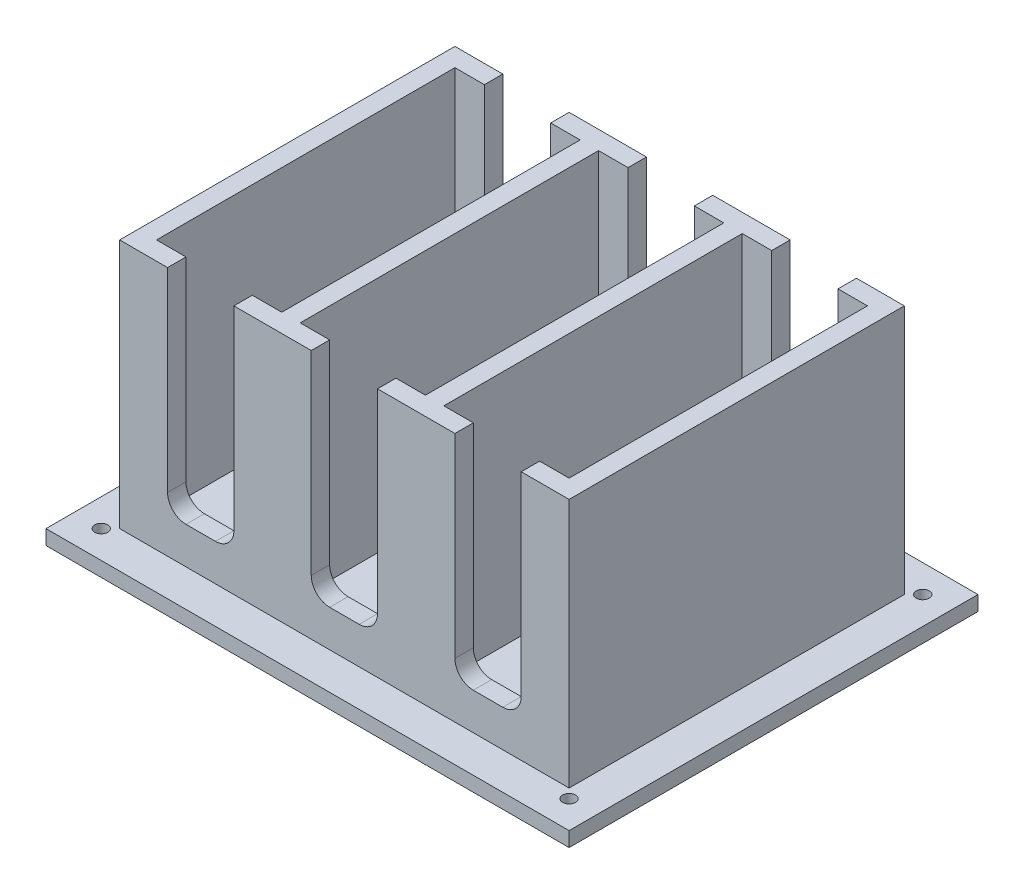
from build123d import *

# Parameters (mm, degrees)
SKETCH1_W           = 142
SKETCH1_H           = 111
SKETCH1_R           = 1.75
BOSS_EXTRUDE1_DEPTH = 4
BOSS_EXTRUDE3_DEPTH = 67.86200042
SKETCH6_W           = 122
SKETCH6_H           = 91
SKETCH6_W_2         = 112
SKETCH6_H_2         = 81
BOSS_EXTRUDE4_DEPTH = 10
FILLET1_R           = 5
SKETCH7_W           = 24.5
SKETCH7_H           = 81
BOSS_EXTRUDE5_DEPTH = 3.28853691


with BuildPart() as part:
    # Sketch1 → Boss-Extrude1 (new body)
    with BuildSketch(Plane(origin=(0, 0, 0), x_dir=(1, 0, 0), z_dir=(0, 1, 0))):
        Rectangle(SKETCH1_W, SKETCH1_H)
        with Locations((-63.5, 48)):
            Circle(SKETCH1_R, mode=Mode.SUBTRACT)
        with Locations((-63.5, -48)):
            Circle(SKETCH1_R, mode=Mode.SUBTRACT)
        with Locations((63.5, 48)):
            Circle(SKETCH1_R, mode=Mode.SUBTRACT)
        with Locations((63.5, -48)):
            Circle(SKETCH1_R, mode=Mode.SUBTRACT)
    extrude(amount=BOSS_EXTRUDE1_DEPTH)

    # Sketch5 → Boss-Extrude3 (add)
    with BuildSketch(Plane(origin=(0, 4, 0), x_dir=(1, 0, 0), z_dir=(0, 1, 0))):
        Polygon((-56, -40.5), (-56, 40.5), (-48, 40.5), (-48, 45.5), (-61, 45.5), (-61, -45.5), (-48, -45.5), (-48, -40.5), align=None)
        Polygon((-9, 45.5), (-9, 40.5), (-17, 40.5), (-17, -40.5), (-9, -40.5), (-9, -45.5), (-30, -45.5), (-30, -40.5), (-22, -40.5), (-22, 40.5), (-30, 40.5), (-30, 45.5), align=None)
        Polygon((17, -40.5), (17, 40.5), (9, 40.5), (9, 45.5), (30, 45.5), (30, 40.5), (22, 40.5), (22, -40.5), (30, -40.5), (30, -45.5), (9, -45.5), (9, -40.5), align=None)
        Polygon((56, -40.5), (56, 40.5), (48, 40.5), (48, 45.5), (61, 45.5), (61, 40.5), (61, -40.5), (61, -45.5), (48, -45.5), (48, -40.5), align=None)
    extrude(amount=BOSS_EXTRUDE3_DEPTH)

    # Sketch6 → Boss-Extrude4 (add)
    with BuildSketch(Plane(origin=(0, 4, 0), x_dir=(1, 0, 0), z_dir=(0, 1, 0))):
        Rectangle(SKETCH6_W, SKETCH6_H)
        Rectangle(SKETCH6_W_2, SKETCH6_H_2, mode=Mode.SUBTRACT)
    extrude(amount=BOSS_EXTRUDE4_DEPTH)

    # Fillet1
    fillet1_edges = [part.edges().sort_by_distance(p)[0] for p in [
        (-30, 14, -43),
        (-48, 14, -43),
        (-9, 14, -43),
        (9, 14, -43),
        (30, 14, -43),
        (48, 14, -43),
        (48, 14, 43),
        (30, 14, 43),
        (-9, 14, 43),
        (9, 14, 43),
        (-48, 14, 43),
        (-30, 14, 43),
    ]]
    fillet(fillet1_edges, radius=FILLET1_R)

    # Sketch7 → Boss-Extrude5 (add)
    with BuildSketch(Plane(origin=(0, 4, 0), x_dir=(1, 0, 0), z_dir=(0, 1, 0))):
        with Locations((-43.75, 0)):
            Rectangle(SKETCH7_W, SKETCH7_H)
        with Locations((-4.75, 0)):
            Rectangle(SKETCH7_W, SKETCH7_H)
        with Locations((34.25, 0)):
            Rectangle(SKETCH7_W, SKETCH7_H)
    extrude(amount=BOSS_EXTRUDE5_DEPTH)


solid = part.part
